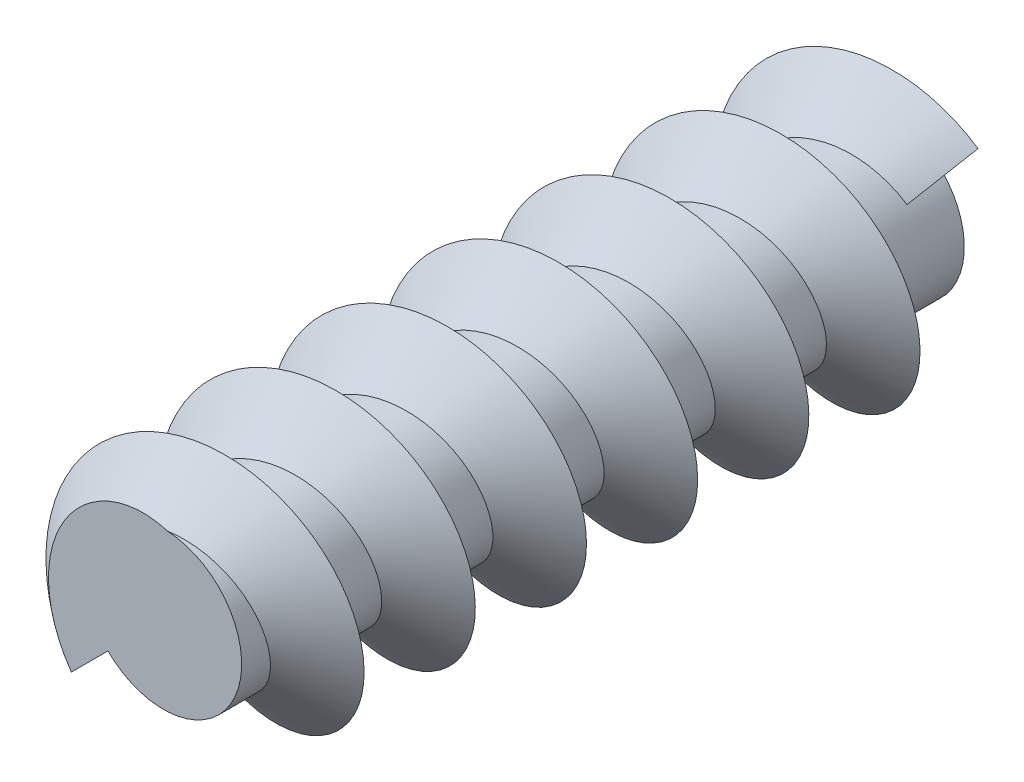
from build123d import *
from build123d.topology import SkipClean

# Parameters (mm, degrees)
SKETCH1_R           = 6.5
BOSS_EXTRUDE1_DEPTH = 60
SWEEP1_PITCH        = 9.230769231
SPLIT1_START        = 60
SPLIT1_DEPTH        = 6


with BuildPart() as part:
    # Sketch1 → Boss-Extrude1 (new body)
    with BuildSketch(Plane.XY):
        Circle(SKETCH1_R)
    extrude(amount=BOSS_EXTRUDE1_DEPTH)

    # Sweep1: arcs per turn and ends read off the stored shape
    # Sweep1: the profile of Sketch3 screwed along a right-hand helix through 6.5 turns, 16 arcs to a turn; built about Z, then put on its axis
    with SkipClean():  # the faces are left unmerged after this step: merging them gives an invalid solid
        sweep1_z = Axis((0, 0, 0), (0, 0, 1))
        sweep1_corners = [(4.5, -1.102289962, 4.87698235), (4.5, 0, 0), (6.5, 0, 0), (10.8, 0, 0)]
        with BuildLine(mode=Mode.PRIVATE) as sweep1_profile:
            Line(sweep1_corners[0], sweep1_corners[1])
            Line(sweep1_corners[1], sweep1_corners[2])
            Line(sweep1_corners[2], sweep1_corners[3])
            Line(sweep1_corners[3], sweep1_corners[0])
        sweep1_cap = Face(sweep1_profile.wire())
        sweep1_turn_angles = [0, 11.25, 22.5, 33.75, 45, 56.25, 67.5, 78.75, 90, 101.25, 112.5, 123.75, 135, 146.25, 157.5, 168.75, 180, 191.25, 202.5, 213.75, 225, 236.25, 247.5, 258.75, 270, 281.25, 292.5, 303.75, 315, 326.25, 337.5, 348.75, 360]
        sweep1_turn_weights = [1, 0.9807852804032304, 1, 0.9807852804032304, 1, 0.9807852804032304, 1, 0.9807852804032304, 1, 0.9807852804032304, 1, 0.9807852804032304, 1, 0.9807852804032304, 1, 0.9807852804032304, 1, 0.9807852804032304, 1, 0.9807852804032304, 1, 0.9807852804032304, 1, 0.9807852804032304, 1, 0.9807852804032304, 1, 0.9807852804032304, 1, 0.9807852804032304, 1, 0.9807852804032304, 1]
        sweep1_turn_rails = [Edge.make_bspline([Vector(p[0], p[1], 0).rotate(sweep1_z, sweep1_turn_angles[k]) / sweep1_turn_weights[k] + Vector(0, 0, p[2] + SWEEP1_PITCH * sweep1_turn_angles[k] / 360) for k in range(33)], [0, 0, 0, 1, 1, 2, 2, 3, 3, 4, 4, 5, 5, 6, 6, 7, 7, 8, 8, 9, 9, 10, 10, 11, 11, 12, 12, 13, 13, 14, 14, 15, 15, 16, 16, 16], 2, sweep1_turn_weights) for p in sweep1_corners]
        sweep1_turn_sides = [Face.make_surface_from_curves(sweep1_turn_rails[p[0]], sweep1_turn_rails[p[1]]) for p in [(0, 1), (1, 2), (2, 3), (3, 0)]]
        sweep1_last_angles = [2160, 2171.25, 2182.5, 2193.75, 2205, 2216.25, 2227.5, 2238.75, 2250, 2261.25, 2272.5, 2283.75, 2295, 2306.25, 2317.5, 2328.75, 2340]
        sweep1_last_weights = [1, 0.9807852804032304, 1, 0.9807852804032304, 1, 0.9807852804032304, 1, 0.9807852804032304, 1, 0.9807852804032304, 1, 0.9807852804032304, 1, 0.9807852804032304, 1, 0.9807852804032119, 1]
        sweep1_last_rails = [Edge.make_bspline([Vector(p[0], p[1], 0).rotate(sweep1_z, sweep1_last_angles[k]) / sweep1_last_weights[k] + Vector(0, 0, p[2] + SWEEP1_PITCH * sweep1_last_angles[k] / 360) for k in range(17)], [0, 0, 0, 1, 1, 2, 2, 3, 3, 4, 4, 5, 5, 6, 6, 7, 7, 8, 8, 8], 2, sweep1_last_weights) for p in sweep1_corners]
        sweep1_last_sides = [Face.make_surface_from_curves(sweep1_last_rails[p[0]], sweep1_last_rails[p[1]]) for p in [(0, 1), (1, 2), (2, 3), (3, 0)]]
        sweep1 = Plane(origin=(0, 0, 0), x_dir=(0.7071067811865512, 0.7071067811865438, 0), z_dir=(0, 0, 1)) * Solid(Shell([*[p.moved(Location((0, 0, SWEEP1_PITCH * i))) for i in range(6) for p in sweep1_turn_sides], *sweep1_last_sides, sweep1_cap, sweep1_cap.rotate(sweep1_z, 2340).moved(Location((0, 0, SWEEP1_PITCH * 2340 / 360)))]))
        add(sweep1)

    # Split1: read off the stored shape, not the designer's step
    # Split1 outline → Split1 (cut)
    with SkipClean():  # the faces are left unmerged after this step: merging them gives an invalid solid
        with BuildSketch(Plane.XY.offset(SPLIT1_START)):
            with BuildLine():
                add(Edge.make_bspline(
                    [(-4.596194078, -4.596194078), (-7.636753237, -7.636753237)],
                    knots=[0, 0, 1, 1], degree=1))
                ThreePointArc((-4.596194078, -4.596194078), (5.941360674, -2.63632952), (0.323880552, 6.491925861))
                add(Edge.make_bspline(
                    [(-7.636753237, -7.636753237), (-7.794347992, -7.415400039), (-7.943207114, -7.187823025), (-8.222537633, -6.721729217), (-8.353013653, -6.483215191), (-8.595021666, -5.996078867), (-8.706509091, -5.74743444), (-8.909459801, -5.2420161), (-9.00091937, -4.985240689), (-9.125362291, -4.586434341), (-9.165740126, -4.446666915), (-9.240515475, -4.165524536), (-9.274912851, -4.024149546), (-9.322010118, -3.81110994), (-9.336959252, -3.739934761), (-9.365253874, -3.597266635), (-9.378599385, -3.525773692), (-9.416195451, -3.310873935), (-9.438008357, -3.167033507), (-9.475068117, -2.878629126), (-9.490320299, -2.734065858), (-9.514242525, -2.444405784), (-9.522912351, -2.299308961), (-9.53899465, -1.863608592), (-9.536486197, -1.572546492), (-9.513243722, -1.144656071), (-9.502782431, -1.007172838), (-9.475909495, -0.732772864), (-9.459497752, -0.595856134), (-9.420750107, -0.32287691), (-9.398414814, -0.186814331), (-9.360490783, 0.016444798), (-9.34711228, 0.084060055), (-9.318899692, 0.21898601), (-9.30406561, 0.286296708), (-9.257209355, 0.487712357), (-9.222836901, 0.621280605), (-9.147919993, 0.886657341), (-9.107375513, 1.018465822), (-8.976586736, 1.410803177), (-8.877164429, 1.668341414), (-8.66163349, 2.157151029), (-8.546960473, 2.389057187), (-8.360010287, 2.728637288), (-8.295191423, 2.840468711), (-8.160675021, 3.061175127), (-8.090977199, 3.170049948), (-7.946856287, 3.384600376), (-7.872434043, 3.490276552), (-7.75734333, 3.6462216), (-7.718404606, 3.697773757), (-7.639300646, 3.799928056), (-7.599135414, 3.850530203), (-7.476888373, 4.000847939), (-7.393020426, 4.099122007), (-7.220681791, 4.291586239), (-7.132209619, 4.385775069), (-6.872256784, 4.649607654), (-6.695285485, 4.813902364), (-6.327363486, 5.125997274), (-6.136413606, 5.273798441), (-5.840680042, 5.482175037), (-5.740538435, 5.549420151), (-5.537343605, 5.67931359), (-5.434291102, 5.741963041), (-5.225507343, 5.862584721), (-5.119776589, 5.920557817), (-4.90560781, 6.031280548), (-4.797169767, 6.084030149), (-4.585552808, 6.180676587), (-4.482538931, 6.224934914), (-4.274617917, 6.308725198), (-4.169710769, 6.34825713), (-3.852406831, 6.45963516), (-3.637405192, 6.524273704), (-3.311298808, 6.606249818), (-3.202005572, 6.631076749), (-2.982381504, 6.675695786), (-2.872050643, 6.695487752), (-2.650607905, 6.729978463), (-2.539496125, 6.744677834), (-2.372418334, 6.762866521), (-2.31665634, 6.768286087), (-2.205022441, 6.777853102), (-2.149150536, 6.782000561), (-2.041474824, 6.788685318), (-1.989677046, 6.791319319), (-1.886035416, 6.795380733), (-1.834191564, 6.796808157), (-1.678635255, 6.79929266), (-1.574888546, 6.798552563), (-1.367555652, 6.792255864), (-1.263969448, 6.786699899), (-1.057176027, 6.770774852), (-0.953968821, 6.760405644), (-0.645334088, 6.7220874), (-0.440732625, 6.686922885), (-0.137072366, 6.619912466), (-0.03637188, 6.595191722), (0.150932814, 6.544505502), (0.237688551, 6.519106265), (0.323880552, 6.491925861)],
                    knots=[0, 0, 0, 0, 0.81496675, 0.81496675, 1.62972823, 1.62972823, 2.44637644, 2.44637644, 3.263176015, 3.263176015, 3.699516789, 3.699516789, 4.135867594, 4.135867594, 4.354037655, 4.354037655, 4.572204698, 4.572204698, 5.008499844, 5.008499844, 5.444440002, 5.444440002, 5.880394547, 5.880394547, 6.752156994, 6.752156994, 7.165704457, 7.165704457, 7.579258741, 7.579258741, 7.992770659, 7.992770659, 8.199534855, 8.199534855, 8.40629845, 8.40629845, 8.819887379, 8.819887379, 9.233477945, 9.233477945, 10.060360083, 10.060360083, 10.835438586, 10.835438586, 11.223106822, 11.223106822, 11.61079757, 11.61079757, 11.99841904, 11.99841904, 12.192219565, 12.192219565, 12.38601942, 12.38601942, 12.773443438, 12.773443438, 13.160993029, 13.160993029, 13.884405858, 13.884405858, 14.607776254, 14.607776254, 14.969546345, 14.969546345, 15.331227516, 15.331227516, 15.692841404, 15.692841404, 16.05445756, 16.05445756, 16.390693926, 16.390693926, 16.726932096, 16.726932096, 17.399334972, 17.399334972, 17.735478647, 17.735478647, 18.071631725, 18.071631725, 18.407743476, 18.407743476, 18.57580562, 18.57580562, 18.743866584, 18.743866584, 18.89944663, 18.89944663, 19.055025415, 19.055025415, 19.366154471, 19.366154471, 19.677242395, 19.677242395, 19.988338501, 19.988338501, 20.610049797, 20.610049797, 20.921035563, 20.921035563, 21.192137663, 21.192137663, 21.192137663, 21.192137663], degree=3))
            make_face()
        extrude(amount=SPLIT1_DEPTH, mode=Mode.SUBTRACT)


solid = part.part
